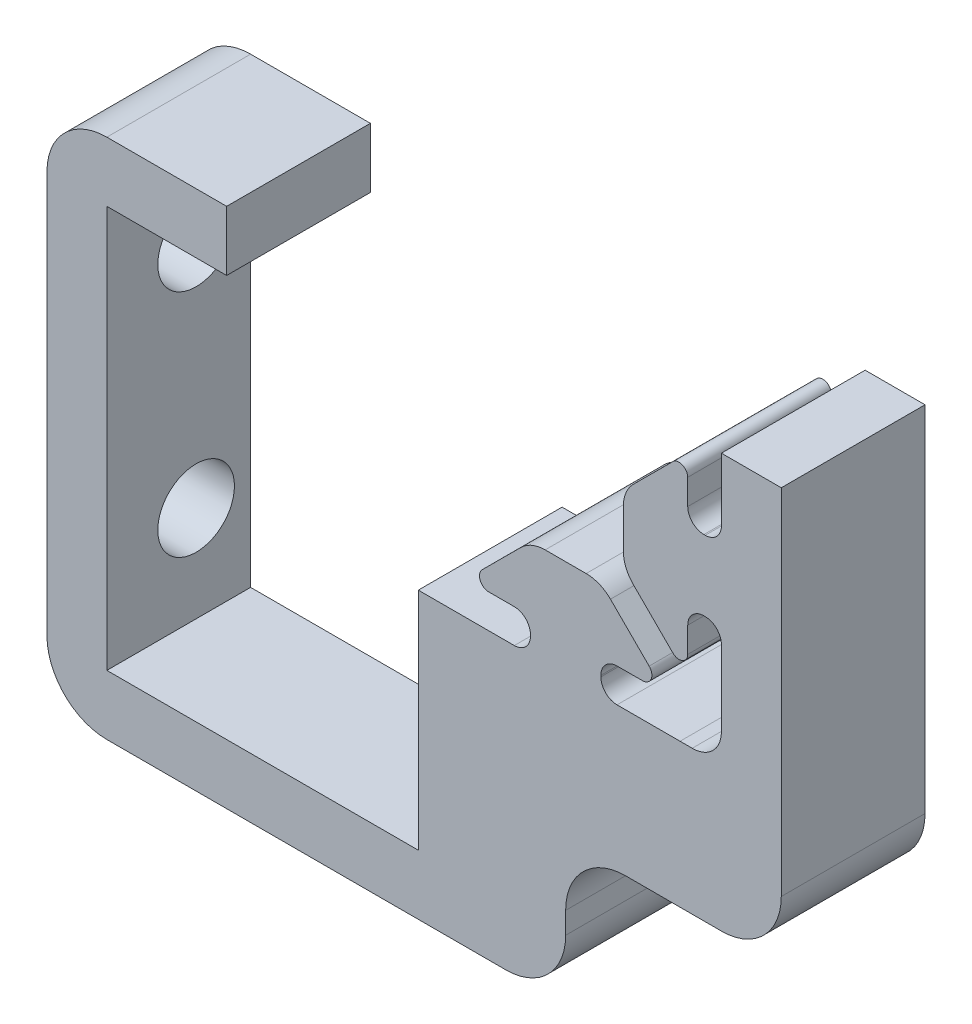
from build123d import *

# Parameters (mm, degrees)
BOSS_EXTRUDE1_DEPTH     = 12
FILLET1_R               = 5
FILLET2_R               = 5
CUT_EXTRUDE1_REACH      = 74.499
SKETCH3_R               = 3.2
CHAMFER1_SIZE           = 0.2
CUT_EXTRUDE2_DEPTH      = 76.419667653
CUT_EXTRUDE2_DEPTH_BACK = 76.419667653
SKETCH4_W               = 23.729387498
SKETCH4_H               = 55.299704447


with BuildPart() as part:
    # Sketch2 → Boss-Extrude1 (new body)
    with BuildSketch(Plane.XY):
        with BuildLine():
            Line((-10.5918, -13), (-5.317126718, -13))
            Line((-5.317126718, -13), (-4.287512407, -13))
            ThreePointArc((-4.287512407, -13), (-3.333616586, -12.604883414), (-2.9385, -11.650987593))
            Line((-2.9385, -11.650987593), (-2.9385, -11.539212407))
            ThreePointArc((-2.9385, -11.539212407), (-3.333616586, -10.585316586), (-4.287512407, -10.1902))
            Line((-4.287512407, -10.1902), (-6.416408329, -10.1902))
            ThreePointArc((-6.416408329, -10.1902), (-7.137514675, -9.708134418), (-6.967711912, -8.857517813))
            Line((-6.967711912, -8.857517813), (-3.740331666, -5.636015806))
            ThreePointArc((-3.740331666, -5.636015806), (-2.808257752, -5.01414519), (-1.709253557, -4.7958))
            Line((-1.709253557, -4.7958), (1.709253557, -4.7958))
            ThreePointArc((1.709253557, -4.7958), (2.808257752, -5.01414519), (3.740331666, -5.636015806))
            Line((3.740331666, -5.636015806), (6.967711912, -8.857517813))
            ThreePointArc((6.967711912, -8.857517813), (7.137514675, -9.708134418), (6.416408329, -10.1902))
            Line((6.416408329, -10.1902), (4.287512407, -10.1902))
            ThreePointArc((4.287512407, -10.1902), (3.333616586, -10.585316586), (2.9385, -11.539212407))
            Line((2.9385, -11.539212407), (2.9385, -11.650987593))
            ThreePointArc((2.9385, -11.650987593), (3.333616586, -12.604883414), (4.287512407, -13))
            Line((4.287512407, -13), (5.317126718, -13))
            Line((5.317126718, -13), (9.550465633, -13))
            Line((9.550465633, -13), (10.564722121, -12.999847763))
            ThreePointArc((10.564722121, -12.999847763), (12.294654751, -12.29465435), (12.999847757, -10.564721553))
            Line((12.999847757, -10.564721553), (13, -9.550422515))
            Line((13, -9.550422515), (13, -6.3330836))
            Line((13, -6.3330836), (13, -5.3170836))
            Line((13, -5.3170836), (13, -4.287469289))
            ThreePointArc((13, -4.287469289), (12.604883414, -3.333573468), (11.650987593, -2.938456882))
            Line((11.650987593, -2.938456882), (11.539212407, -2.938456882))
            ThreePointArc((11.539212407, -2.938456882), (10.585316586, -3.333573468), (10.1902, -4.287469289))
            Line((10.1902, -4.287469289), (10.1902, -6.402089023))
            ThreePointArc((10.1902, -6.402089023), (9.74154152, -7.073969797), (8.94902056, -6.917034355))
            Line((8.94902056, -6.917034355), (5.652895046, -3.628441884))
            ThreePointArc((5.652895046, -3.628441884), (5.027976112, -2.694919539), (4.8085, -1.593185507))
            Line((4.8085, -1.593185507), (4.8085, 1.593185507))
            ThreePointArc((4.8085, 1.593185507), (5.027976112, 2.694919539), (5.652895046, 3.628441884))
            Line((5.652895046, 3.628441884), (8.94902056, 6.917034355))
            ThreePointArc((8.94902056, 6.917034355), (9.74154152, 7.073969797), (10.1902, 6.402089023))
            Line((10.1902, 6.402089023), (10.1902, 4.287469289))
            ThreePointArc((10.1902, 4.287469289), (10.585316586, 3.333573468), (11.539212407, 2.938456882))
            Line((11.539212407, 2.938456882), (11.650987593, 2.938456882))
            ThreePointArc((11.650987593, 2.938456882), (12.604883414, 3.333573468), (13, 4.287469289))
            Line((13, 4.287469289), (13, 5.3170836))
            Line((13, 5.3170836), (13, 6.3330836))
            Line((13, 6.3330836), (13, 9.550422515))
            Line((13, 9.550422515), (18, 9.550422515))
            Line((18, 9.550422515), (18, -25))
            Line((18, -25), (0, -25))
            Line((0, -25), (0, -36.8026666))
            Line((0, -36.8026666), (-12, -36.8026666))
            Line((-12, -36.8026666), (-43.3, -36.8026666))
            Line((-43.3, -36.8026666), (-43.3, -31.8026666))
            Line((-43.3, -31.8026666), (-43.3, 6.7473334))
            Line((-43.3, 6.7473334), (-28.3, 6.7473334))
            Line((-28.3, 6.7473334), (-28.3, 1.7473334))
            Line((-28.3, 1.7473334), (-38.3, 1.7473334))
            Line((-38.3, 1.7473334), (-38.3, -31.8026666))
            Line((-38.3, -31.8026666), (-12.3, -31.8026666))
            Line((-12.3, -31.8026666), (-12.3, -13))
            Line((-12.3, -13), (-10.5918, -13))
        make_face()
    extrude(amount=BOSS_EXTRUDE1_DEPTH)

    # Fillet1
    fillet1_edges = [part.edges().sort_by_distance(p)[0] for p in [
        (0, -25, 6),
        (0, -36.8026666, 6),
        (18, -25, 6),
    ]]
    fillet(fillet1_edges, radius=FILLET1_R)

    # Fillet2
    fillet2_edges = [part.edges().sort_by_distance(p)[0] for p in [
        (-43.3, 6.7473334, 6),
        (-43.3, -36.8026666, 6),
    ]]
    fillet(fillet2_edges, radius=FILLET2_R)

    # Sketch3 → Cut-Extrude1 (cut, up to next)
    with BuildSketch(Plane.ZY.offset(43.3), mode=Mode.PRIVATE) as cut_extrude1_sk1:
        with Locations((7.45, -23.7926666)):
            Circle(SKETCH3_R)
    cut_extrude1_tool1 = extrude(cut_extrude1_sk1.sketch, amount=-CUT_EXTRUDE1_REACH, mode=Mode.PRIVATE) & part.part
    # Sketch3 → Cut-Extrude1 (cut, up to next)
    with BuildSketch(Plane.ZY.offset(43.3), mode=Mode.PRIVATE) as cut_extrude1_sk2:
        with Locations((7.45, -4.5926666)):
            Circle(SKETCH3_R)
    cut_extrude1_tool2 = extrude(cut_extrude1_sk2.sketch, amount=-CUT_EXTRUDE1_REACH, mode=Mode.PRIVATE) & part.part
    add(cut_extrude1_tool1.solids().sort_by_distance((-43.3, -23.792667, 7.45))[0], mode=Mode.SUBTRACT)
    add(cut_extrude1_tool2.solids().sort_by_distance((-43.3, -4.592667, 7.45))[0], mode=Mode.SUBTRACT)

    # Chamfer1
    chamfer1_edges = [part.edges().sort_by_distance(p)[0] for p in [
        (-43.3, -4.5926666, 4.25),
        (-43.3, -23.7926666, 4.25),
    ]]
    chamfer(chamfer1_edges, length=CHAMFER1_SIZE)


with BuildPart() as body_2:
    # Mirror1: mirrored copy
    add(part.part.mirror(Plane(origin=(11.650987593, 4.287469289, 12), x_dir=(1, 0, 0), z_dir=(0, 0, 1))))


with BuildPart() as part_1:
    add(part.part)

    # Sketch4 → Cut-Extrude2 (cut, two sides: drawn at the far end of the back side and taken through both)
    with BuildSketch(Plane.ZY.offset(43.3).offset(-CUT_EXTRUDE2_DEPTH_BACK)):
        with Locations((0.135306251, -13.030919745)):
            Rectangle(SKETCH4_W, SKETCH4_H)
    extrude(amount=CUT_EXTRUDE2_DEPTH + CUT_EXTRUDE2_DEPTH_BACK, mode=Mode.SUBTRACT)


solid = body_2.part
